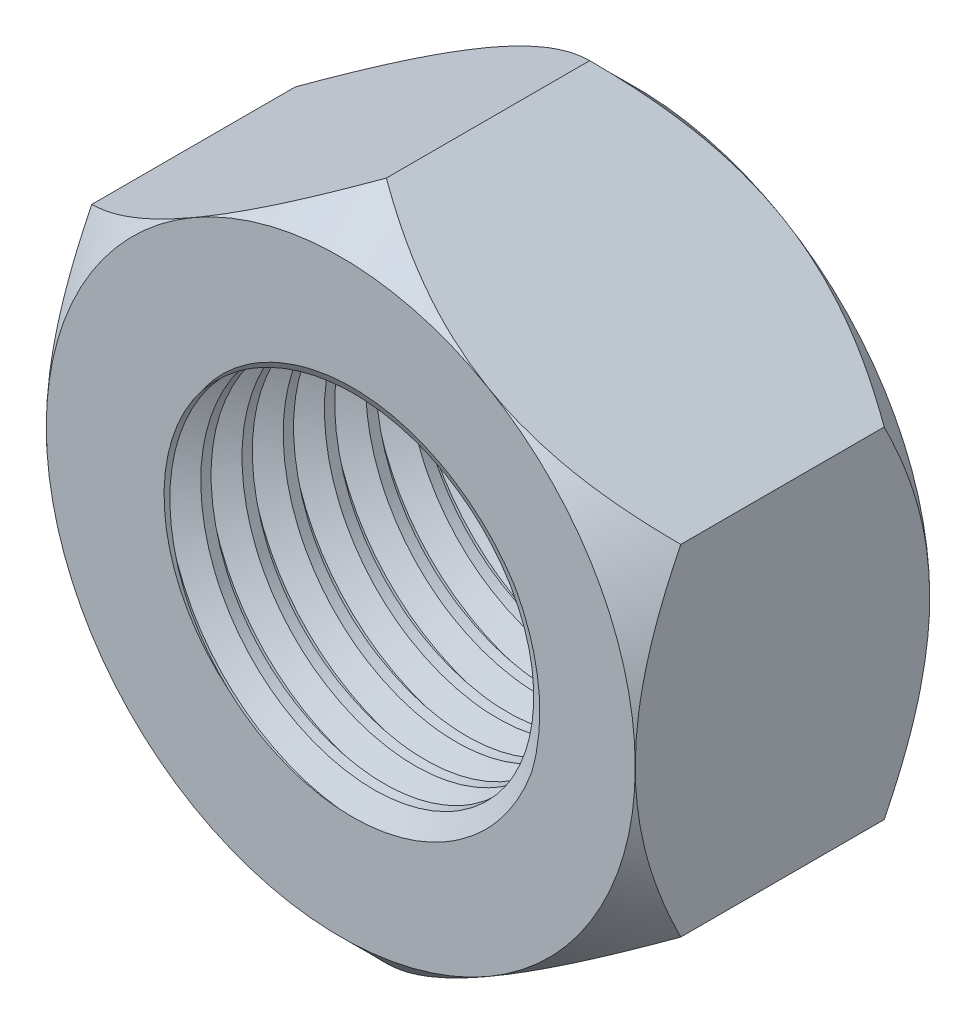
from build123d import *

# Parameters (mm, degrees)
BOSS_EXTRUDE1_DEPTH     = 1.25
SKETCH8_OUTSIDE_W       = 28.608
SKETCH8_OUTSIDE_H       = 29.382
SKETCH8_OUTSIDE_R       = 2.5
CUT_EXTRUDE4_DEPTH      = 10
CUT_EXTRUDE4_DRAFT      = -45
MIRROR1_COPY_1_SKETCH_W = 28.608
MIRROR1_COPY_1_SKETCH_H = 29.382
MIRROR1_COPY_1_SKETCH_R = 2.5
MIRROR1_COPY_1_DEPTH    = 10
MIRROR1_COPY_1_DRAFT    = -45
CUT_EXTRUDE5_DEPTH      = 10
CUT_EXTRUDE5_DEPTH_BACK = 10
SKETCH1_4_R             = 1.5
THREAD2_PITCH           = 0.35


with BuildPart() as part:
    # Sketch1 → Boss-Extrude1 (new, symmetric)
    with BuildSketch(Plane.XY):
        Polygon((0, 2.886751346), (-2.5, 1.443375673), (-2.5, -1.443375673), (0, -2.886751346), (2.5, -1.443375673), (2.5, 1.443375673), align=None)
    extrude(amount=BOSS_EXTRUDE1_DEPTH, both=True)


with BuildPart() as cut_extrude4_tool:
    # Sketch8 outside → Cut-Extrude4 (with draft: the straight prism first)
    with BuildSketch(Plane.XY.offset(1.25)):
        Rectangle(SKETCH8_OUTSIDE_W, SKETCH8_OUTSIDE_H)
        Circle(SKETCH8_OUTSIDE_R, mode=Mode.SUBTRACT)
    extrude(amount=-CUT_EXTRUDE4_DEPTH)
    # Cut-Extrude4: the draft: its side faces are tilted about the plane it starts from
    cut_extrude4_sides = [cut_extrude4_tool.faces().sort_by_distance(p)[0] for p in [
        (0, -14.691, -3.75),
        (14.304, 0, -3.75),
        (0, 14.691, -3.75),
        (-14.304, 0, -3.75),
        (-2.5, 0, -3.75),
    ]]
    draft(cut_extrude4_sides, Plane.XY.offset(1.25), CUT_EXTRUDE4_DRAFT)


with BuildPart() as part_1:
    add(part.part)

    # Cut-Extrude4: cut by cut_extrude4_tool
    add(cut_extrude4_tool.part, mode=Mode.SUBTRACT)


with BuildPart() as mirror1_copy_1_tool:
    # Mirror1 copy 1 sketch → Mirror1 copy 1 (with draft: the straight prism first)
    with BuildSketch(Plane(origin=(0, 0, -1.25), x_dir=(1, 0, 0), z_dir=(0, 0, -1))):
        Rectangle(MIRROR1_COPY_1_SKETCH_W, MIRROR1_COPY_1_SKETCH_H)
        Circle(MIRROR1_COPY_1_SKETCH_R, mode=Mode.SUBTRACT)
    extrude(amount=-MIRROR1_COPY_1_DEPTH)
    # Mirror1 copy 1: the draft: its side faces are tilted about the plane it starts from
    mirror1_copy_1_sides = [mirror1_copy_1_tool.faces().sort_by_distance(p)[0] for p in [
        (0, -14.691, 3.75),
        (14.304, 0, 3.75),
        (0, 14.691, 3.75),
        (-14.304, 0, 3.75),
        (-2.5, 0, 3.75),
    ]]
    draft(mirror1_copy_1_sides, Plane(origin=(0, 0, -1.25), x_dir=(1, 0, 0), z_dir=(0, 0, -1)), MIRROR1_COPY_1_DRAFT)


with BuildPart() as part_2:
    add(part_1.part)

    # Mirror1 copy 1: cut by mirror1_copy_1_tool
    add(mirror1_copy_1_tool.part, mode=Mode.SUBTRACT)

    # Sketch1<4> → Cut-Extrude5 (cut, two sides: drawn at the far end of the back side and taken through both)
    with BuildSketch(Plane.XY.offset(-CUT_EXTRUDE5_DEPTH_BACK)):
        Circle(SKETCH1_4_R)
    extrude(amount=CUT_EXTRUDE5_DEPTH + CUT_EXTRUDE5_DEPTH_BACK, mode=Mode.SUBTRACT)

    # Thread2: the profile of Thread Profile3 profile screwed along a right-hand helix of 28.571429 turns, 6 arcs to a turn; built about Z, then put on its axis
    thread2_z = Axis((0, 0, 0), (0, 0, 1))
    thread2_corners = [(1.4997, 0, -0.000173205), (1.689443056, 0, 0.109375), (1.689443056, 0, 0.153125), (1.4997, 0, 0.262673204)]
    with BuildLine(mode=Mode.PRIVATE) as thread2_profile:
        Line(thread2_corners[0], thread2_corners[1])
        Line(thread2_corners[1], thread2_corners[2])
        Line(thread2_corners[2], thread2_corners[3])
        Line(thread2_corners[3], thread2_corners[0])
    thread2_cap = Face(thread2_profile.wire())
    thread2_turn_angles = [0, 30, 60, 90, 120, 150, 180, 210, 240, 270, 300, 330, 360]
    thread2_turn_weights = [1, 0.8660254037844387, 1, 0.8660254037844387, 1, 0.8660254037844387, 1, 0.8660254037844387, 1, 0.8660254037844387, 1, 0.8660254037844387, 1]
    thread2_turn_rails = [Edge.make_bspline([Vector(p[0], p[1], 0).rotate(thread2_z, thread2_turn_angles[k]) / thread2_turn_weights[k] + Vector(0, 0, p[2] + THREAD2_PITCH * thread2_turn_angles[k] / 360) for k in range(13)], [0, 0, 0, 1, 1, 2, 2, 3, 3, 4, 4, 5, 5, 6, 6, 6], 2, thread2_turn_weights) for p in thread2_corners]
    thread2_turn_sides = [Face.make_surface_from_curves(thread2_turn_rails[p[0]], thread2_turn_rails[p[1]]) for p in [(0, 1), (1, 2), (2, 3), (3, 0)]]
    thread2_last_angles = [10080, 10110, 10140, 10170, 10200, 10230, 10260, 10272.857142857, 10285.714285714]
    thread2_last_weights = [1, 0.8660254037844387, 1, 0.8660254037844387, 1, 0.8660254037844387, 1, 0.9749279121818226, 1]
    thread2_last_rails = [Edge.make_bspline([Vector(p[0], p[1], 0).rotate(thread2_z, thread2_last_angles[k]) / thread2_last_weights[k] + Vector(0, 0, p[2] + THREAD2_PITCH * thread2_last_angles[k] / 360) for k in range(9)], [0, 0, 0, 1, 1, 2, 2, 3, 3, 4, 4, 4], 2, thread2_last_weights) for p in thread2_corners]
    thread2_last_sides = [Face.make_surface_from_curves(thread2_last_rails[p[0]], thread2_last_rails[p[1]]) for p in [(0, 1), (1, 2), (2, 3), (3, 0)]]
    thread2 = Plane(origin=(0, 0, 2.25), x_dir=(-1, 0, 0), z_dir=(0, 0, -1)) * Solid(Shell([*[p.moved(Location((0, 0, THREAD2_PITCH * i))) for i in range(28) for p in thread2_turn_sides], *thread2_last_sides, thread2_cap, thread2_cap.rotate(thread2_z, 10285.714285714).moved(Location((0, 0, THREAD2_PITCH * 10285.714285714 / 360)))]))
    add(thread2, mode=Mode.SUBTRACT)


solid = part_2.part
